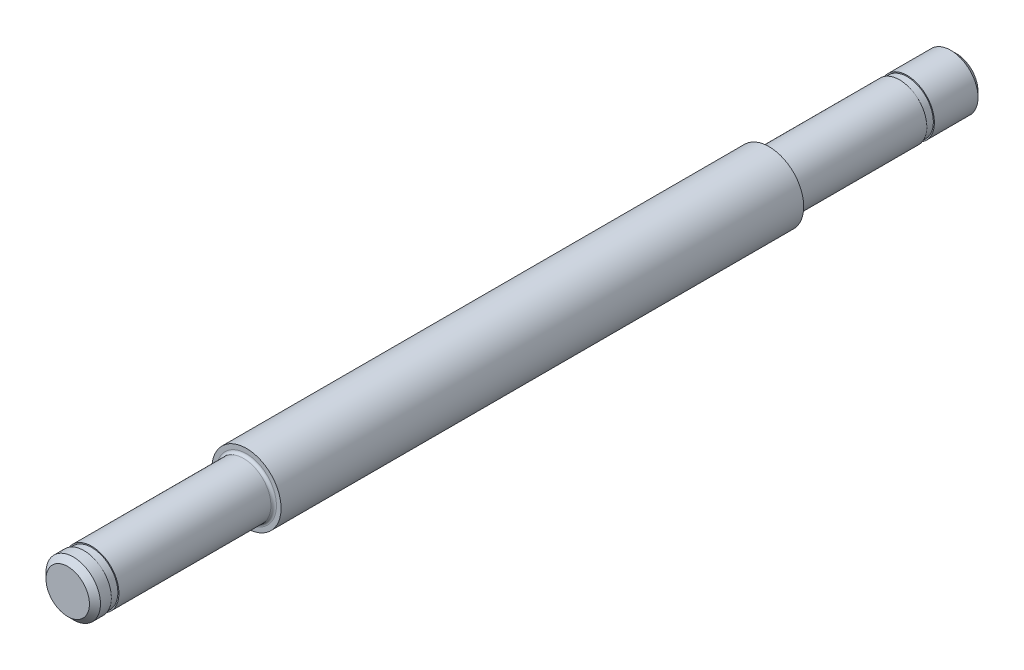
from build123d import *

# Parameters (mm, degrees)
SKETCH1_R           = 2.5
BOSS_EXTRUDE1_DEPTH = 40.767
SKETCH2_W           = 0.7
SKETCH2_H           = 0.1
SKETCH5_R           = 3.175
BOSS_EXTRUDE3_DEPTH = 47.9552
SKETCH7_W           = 0.7
SKETCH7_H           = 0.1
CHAMFER1_SIZE       = 0.508
FILLET1_R           = 0.254


with BuildPart() as part:
    # Sketch1 → Boss-Extrude1 (new, symmetric)
    with BuildSketch(Plane.XY):
        Circle(SKETCH1_R)
    extrude(amount=BOSS_EXTRUDE1_DEPTH, both=True)

    # Sketch2 → Cut-Revolve1 (revolve, cut)
    with BuildSketch(Plane(origin=(0, 0, 0), x_dir=(0, 0, -1), z_dir=(1, 0, 0))):
        with Locations((-38.914555436, 2.45)):
            Rectangle(SKETCH2_W, SKETCH2_H)
    revolve(axis=Axis((0, 0, 40.767), (0, 0, -1)), mode=Mode.SUBTRACT)

    # Sketch5 → Boss-Extrude3 (add)
    with BuildSketch(Plane(origin=(0, 0, 24.364555436), x_dir=(-1, 0, 0), z_dir=(0, 0, -1))):
        Circle(SKETCH5_R)
    extrude(amount=BOSS_EXTRUDE3_DEPTH)

    # Sketch7 → Cut-Revolve2 (revolve, cut)
    with BuildSketch(Plane(origin=(0, -92.71594082, 0), x_dir=(0, 0, 1), z_dir=(1, 0, 0))):
        with Locations((-35.912002714, -95.16594082)):
            Rectangle(SKETCH7_W, SKETCH7_H)
    revolve(axis=Axis((0, 0, -23.590644564), (0, 0, -1)), mode=Mode.SUBTRACT)

    # Chamfer1
    chamfer1_edges = [part.edges().sort_by_distance(p)[0] for p in [
        (-2.5, 0, 40.767),
        (-2.5, 0, -40.767),
    ]]
    chamfer(chamfer1_edges, length=CHAMFER1_SIZE)

    # Fillet1
    fillet1_edges = [part.edges().sort_by_distance(p)[0] for p in [
        (-2.5, 0, -23.590644564),
        (-2.5, 0, 24.364555436),
    ]]
    fillet(fillet1_edges, radius=FILLET1_R)


solid = part.part
